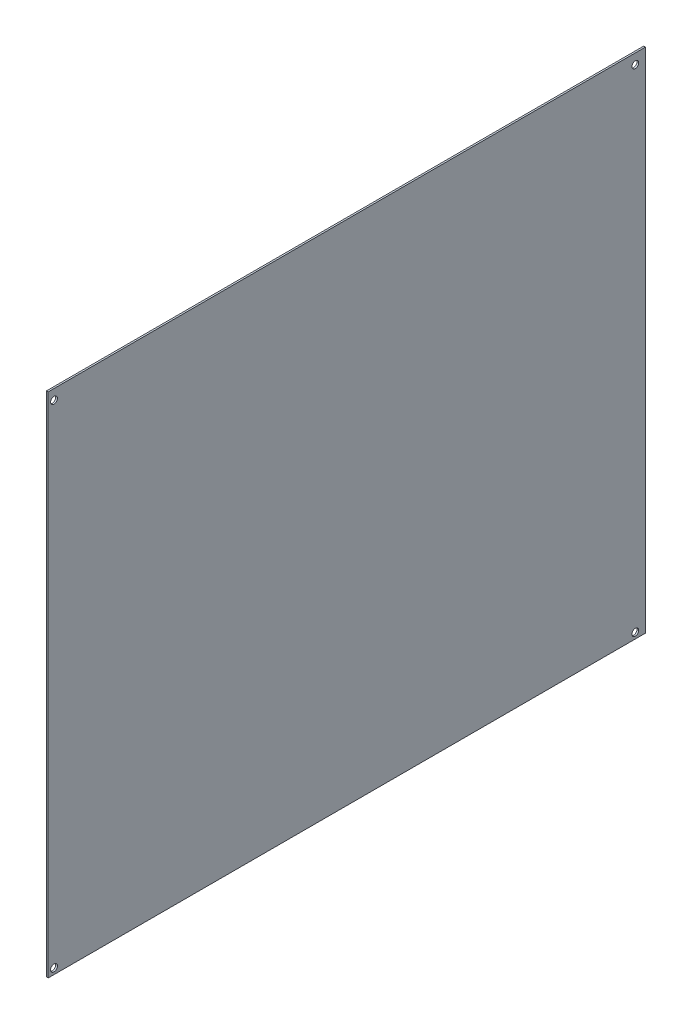
from build123d import *

# Parameters (mm, degrees)
SKETCH1_W           = 556.265269683
SKETCH1_H           = 472.697540701
SKETCH1_R           = 3.175
BOSS_EXTRUDE1_DEPTH = 1.6002


with BuildPart() as part:
    # Sketch1 → Boss-Extrude1 (new body)
    with BuildSketch(Plane.ZY.offset(873.127754017)):
        with Locations((-318.232533311, 276.448668749)):
            Rectangle(SKETCH1_W, SKETCH1_H)
        with Locations((-586.858968152, 503.291239099)):
            Circle(SKETCH1_R, mode=Mode.SUBTRACT)
        with Locations((-45.541032, 503.291239099)):
            Circle(SKETCH1_R, mode=Mode.SUBTRACT)
        with Locations((-45.541032, 45.541031777)):
            Circle(SKETCH1_R, mode=Mode.SUBTRACT)
        with Locations((-586.858968152, 45.541031777)):
            Circle(SKETCH1_R, mode=Mode.SUBTRACT)
    extrude(amount=BOSS_EXTRUDE1_DEPTH)


solid = part.part
